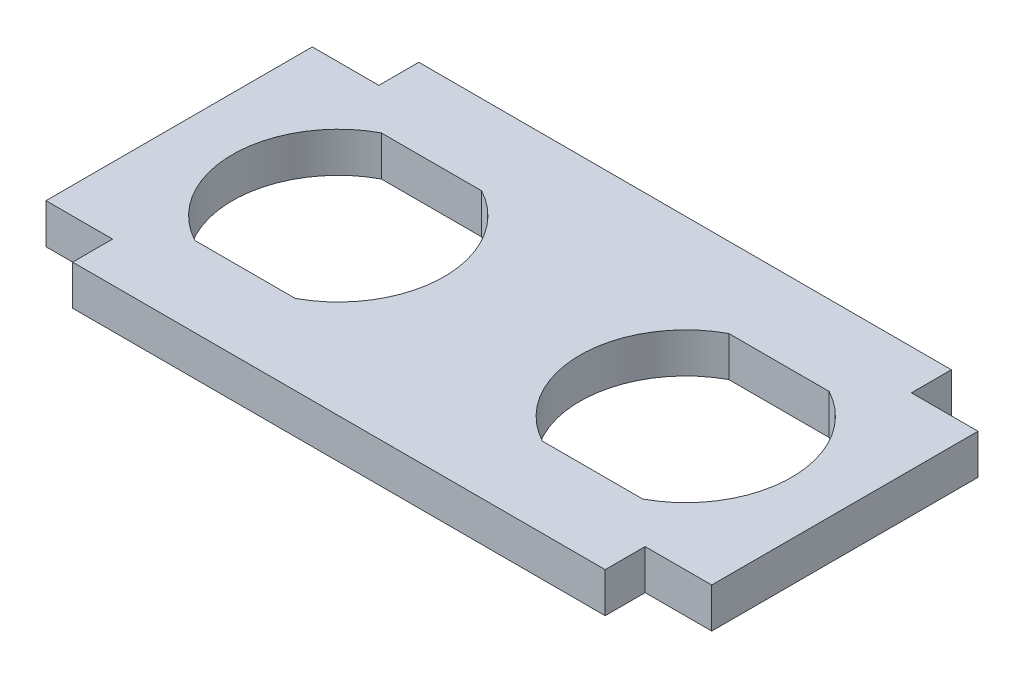
from build123d import *

# Parameters (mm, degrees)
SKETCH_1_W          = 50
SKETCH_1_H          = 20
EXTRUDE_1_DEPTH     = 3
SKETCH_2_R          = 7.95
CUT_EXTRUDE_1_DEPTH = 10
SKETCH_3_W          = 40
SKETCH_3_H          = 6
EXTRUDE_2_DEPTH     = 3


with BuildPart() as part:
    # 草图1 → 凸台-拉伸1 (new body)
    with BuildSketch(Plane(origin=(0, 0, 0), x_dir=(1, 0, 0), z_dir=(0, 1, 0))):
        Rectangle(SKETCH_1_W, SKETCH_1_H)
    extrude(amount=EXTRUDE_1_DEPTH)

    # 草图2 → 切除-拉伸1 (cut)
    with BuildSketch(Plane.XZ):
        with Locations((13.05, 0)):
            Circle(SKETCH_2_R)
        with Locations((-13.05, 0)):
            Circle(SKETCH_2_R)
    extrude(amount=-CUT_EXTRUDE_1_DEPTH, mode=Mode.SUBTRACT)

    # 草图3 → 凸台-拉伸2 (add)
    with BuildSketch(Plane.XZ):
        with Locations((0, -10)):
            Rectangle(SKETCH_3_W, SKETCH_3_H)
        with Locations((0, 10)):
            Rectangle(SKETCH_3_W, SKETCH_3_H)
    extrude(amount=-EXTRUDE_2_DEPTH)


solid = part.part
